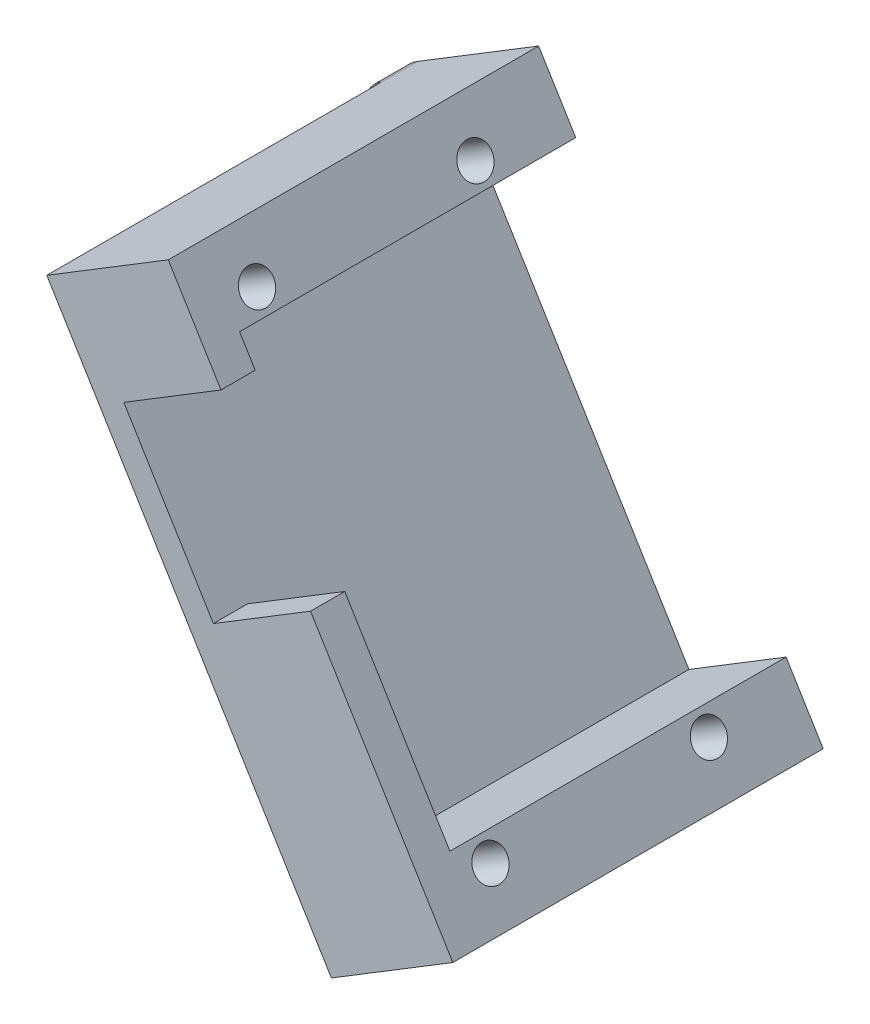
from build123d import *

# Parameters (mm, degrees)
BOSS_EXTRUDE1_DEPTH                               = 3.048
BOSS_EXTRUDE2_DEPTH                               = 29.971999999999998
BOSS_EXTRUDE3_DEPTH                               = 3.048
BOSS_EXTRUDE4_DEPTH                               = 3.048
SKETCH13_W                                        = 29.972
SKETCH13_H                                        = 48.7
BOSS_EXTRUDE5_DEPTH                               = 3.048
CSK_FOR_4_FLAT_HEAD_MACHINE_SCREW_100_D           = 2.9464
CSK_FOR_4_FLAT_HEAD_MACHINE_SCREW_100_CSINK_D     = 5.715
CSK_FOR_4_FLAT_HEAD_MACHINE_SCREW_100_CSINK_ANGLE = 100
CUT_EXTRUDE1_DEPTH                                = 1.397
CUT_EXTRUDE1_DEPTH_BACK                           = 1.397
SKETCH15_R                                        = 9.184035329670005
SKETCH15_R_2                                      = 8.124741076595411
SKETCH15_R_3                                      = 8.201451240556812
SKETCH15_R_4                                      = 5.810172256980604
BOSS_EXTRUDE6_DEPTH                               = 3.048
CSK_FOR_4_FLAT_HEAD_MACHINE_SCREW1_AT_2_COUNT     = 2
CSK_FOR_4_FLAT_HEAD_MACHINE_SCREW1_AT_2_PITCH     = 35.474094707842795
CSK_FOR_4_FLAT_HEAD_MACHINE_SCREW1_AT_3_COUNT     = 2
CSK_FOR_4_FLAT_HEAD_MACHINE_SCREW1_AT_3_PITCH     = 43.70753982500484
CSK_FOR_4_FLAT_HEAD_MACHINE_SCREW1_AT_4_COUNT     = 2
CSK_FOR_4_FLAT_HEAD_MACHINE_SCREW1_AT_4_PITCH     = 25.069264350610375
CUT_EXTRUDE2_DEPTH                                = 3.048
FILLET3_R                                         = 3.8099999999999996
FILLET4_R                                         = 1.27
SKETCH21_W                                        = 2.540000000000001
SKETCH21_H                                        = 33.02
CUT_EXTRUDE3_DEPTH                                = 77.47
FILLET5_R                                         = 0.508
FILLET6_R                                         = 0.508
SKETCH22_W                                        = 123.04970813102194
SKETCH22_H                                        = 134.7131875745612
CUT_EXTRUDE4_DEPTH                                = 61.72200000000001


with BuildPart() as part:
    # Sketch2 → Boss-Extrude1 (new body)
    with BuildSketch(Plane.XY):
        Polygon((-47.58059551455695, 48.12489153745831), (-22.21147896413696, 6.554494312375088), (5.701292889255674, 23.58878817682547), (-19.667823661164306, 65.1591854019087), align=None)
        Polygon((-38.85234269167306, 46.0124042215628), (-20.098991648241444, 15.282747135258976), (-3.0269599336282123, 25.701275492720985), (-21.78031097705982, 56.430932579024805), align=None, mode=Mode.SUBTRACT)
    extrude(amount=BOSS_EXTRUDE1_DEPTH)

    # Sketch3 → Boss-Extrude2 (add)
    with BuildSketch(Plane.XY.offset(3.048)):
        Polygon((2.4490708476218597, 21.604058524728963), (-22.920045702798127, 63.17445574981219), (-44.328373472923126, 50.10962118955482), (-18.95925692250314, 8.539223964471608), align=None)
        Polygon((-38.85234269167306, 46.0124042215628), (-20.098991648241444, 15.282747135258976), (-3.0269599336282087, 25.701275492720985), (-21.78031097705982, 56.430932579024805), align=None, mode=Mode.SUBTRACT)
    extrude(amount=BOSS_EXTRUDE2_DEPTH)

    # Sketch4 → Boss-Extrude3 (add)
    with BuildSketch(Plane.XY.offset(33.02)):
        Polygon((-38.85234269167306, 46.0124042215628), (-37.46131723814535, 43.733039051773666), (-20.389285523532113, 54.15156740923567), (-21.78031097705982, 56.430932579024805), align=None)
        Polygon((-29.47566716995725, 30.647575678410885), (-12.403635455344016, 41.0661040358729), (-3.0269599336282087, 25.701275492720985), (-20.098991648241444, 15.282747135258976), align=None)
    extrude(amount=-BOSS_EXTRUDE3_DEPTH)

    # Sketch12 → Boss-Extrude4 (add)
    with BuildSketch(Plane.XY.offset(3.048)):
        Polygon((2.4490708476218597, 21.604058524728963), (5.701292889255674, 23.58878817682547), (8.120429940678708, 25.065112049236276), (-17.248686609741274, 66.6355092743195), (-22.920045702798127, 63.17445574981219), align=None)
    extrude(amount=-BOSS_EXTRUDE4_DEPTH)

    # Sketch13 → Boss-Extrude5 (add)
    with BuildSketch(Plane(origin=(11.391019162328917, 6.95158362794815, 0), x_dir=(0, 0, -1), z_dir=(0.8536015857306615, 0.5209264178731006, 0))):
        with Locations((-18.034000000000002, 41.515472911157566)):
            Rectangle(SKETCH13_W, SKETCH13_H)
    extrude(amount=BOSS_EXTRUDE5_DEPTH)

    # CSK for #4 Flat Head Machine Screw (100)2 (through all)
    with Locations(Plane(origin=(-10.017308607796087, -6.113250932309213, 0), x_dir=(0, 0, 1), z_dir=(-0.8536015857306615, -0.5209264178731007, 0))):
        with Locations((27.397617355, 61.471448289), (7.925915452, 61.471448289), (7.925915452, 21.515515982), (27.397617355, 21.515515982)):
            CounterSinkHole(CSK_FOR_4_FLAT_HEAD_MACHINE_SCREW_100_D / 2, CSK_FOR_4_FLAT_HEAD_MACHINE_SCREW_100_CSINK_D / 2, counter_sink_angle=CSK_FOR_4_FLAT_HEAD_MACHINE_SCREW_100_CSINK_ANGLE)

    # Sketch14 → Cut-Extrude1 (cut, two sides: drawn at the far end of the back side and taken through both)
    with BuildSketch(Plane(origin=(11.607833965104508, 7.083898938087922, 0), x_dir=(0, 0, -1), z_dir=(0.8536015857306615, 0.5209264178731005, 0)).offset(-CUT_EXTRUDE1_DEPTH_BACK)):
        Polygon((-30.697174143874744, 19.61051598216394), (-30.697174143874744, 14.979833054183299), (-24.09806056703731, 14.979833054183299), (-24.09806056703731, 19.610515982163985), (-24.098060567037347, 23.42051598216399), (-27.39761735545604, 25.325515982163957), (-30.697174143874758, 23.420515982163952), align=None)
        Polygon((-27.39761735545604, 57.661448288693826), (-24.098060567037333, 59.56644828869383), (-24.098060567037336, 63.37644828869381), (-24.098060567037336, 70.99644828869384), (-30.69717414387474, 70.99644828869384), (-30.69717414387474, 63.37644828869381), (-30.69717414387474, 59.56644828869381), align=None)
        Polygon((-7.925915451689084, 57.661448288693826), (-4.626358663270381, 59.56644828869382), (-4.626358663270402, 63.37644828869381), (-4.626358663270402, 70.99644828869384), (-11.225472240107786, 70.99644828869384), (-11.225472240107786, 63.376448288693766), (-11.225472240107747, 59.566448288693785), align=None)
        Polygon((-7.925915451689081, 25.325515982163946), (-11.225472240107791, 23.42051598216395), (-11.225472240107791, 19.610515982163946), (-11.225472240107791, 14.979833054183299), (-4.626358663270366, 14.979833054183299), (-4.626358663270366, 19.610515982163953), (-4.6263586632703655, 23.420515982163952), align=None)
    extrude(amount=CUT_EXTRUDE1_DEPTH + CUT_EXTRUDE1_DEPTH_BACK, mode=Mode.SUBTRACT)

    # Sketch15 → Boss-Extrude6 (add)
    with BuildSketch(Plane(origin=(0, 0, 0), x_dir=(-1, 0, 0), z_dir=(0, 0, -1))):
        with Locations((9.758086495919196, 54.36124573948299)):
            Circle(SKETCH15_R)
        with Locations((39.927818301519274, 35.58488100974543)):
            Circle(SKETCH15_R_2)
        with Locations((25.610425726235285, 18.04643091882164)):
            Circle(SKETCH15_R_3)
        with Locations((-3.4576236647063787, 32.70568986323082)):
            Circle(SKETCH15_R_4)
    extrude(amount=-BOSS_EXTRUDE6_DEPTH)

    # Sketch19 → CSK for #4 Flat Head Machine Screw1 (revolve, cut)
    with BuildSketch(Plane(origin=(3.764373982237945, 32.86032278852424, 3.048), x_dir=(0, -1, 0), z_dir=(1, 0, 0))):
        Polygon((0, 0), (-7.5e-16, 3.0480000000000023), (1.4731999999999932, 3.0480000000000023), (1.4731999999999934, 1.59245498611605), (2.857499999999999, -1.73e-15), align=None)
    csk_for_4_flat_head_machine_screw1 = revolve(axis=Axis((3.764373982237945, 32.86032278852424, 9.39799999999999), (0, 0, -1)), mode=Mode.SUBTRACT)

    # CSK for #4 Flat Head Machine Screw1 at 2: CSK for #4 Flat Head Machine Screw1 ×2
    with Locations(*[Vector(-0.8506492202713736, -0.5257336816789507, 0) * (i * CSK_FOR_4_FLAT_HEAD_MACHINE_SCREW1_AT_2_PITCH) for i in range(1, CSK_FOR_4_FLAT_HEAD_MACHINE_SCREW1_AT_2_COUNT)]):
        add(csk_for_4_flat_head_machine_screw1, mode=Mode.SUBTRACT)

    # CSK for #4 Flat Head Machine Screw1 at 3: CSK for #4 Flat Head Machine Screw1 ×2
    with Locations(*[Vector(-0.997755305773639, 0.06696528802709796, 0) * (i * CSK_FOR_4_FLAT_HEAD_MACHINE_SCREW1_AT_3_PITCH) for i in range(1, CSK_FOR_4_FLAT_HEAD_MACHINE_SCREW1_AT_3_COUNT)]):
        add(csk_for_4_flat_head_machine_screw1, mode=Mode.SUBTRACT)

    # CSK for #4 Flat Head Machine Screw1 at 4: CSK for #4 Flat Head Machine Screw1 ×2
    with Locations(*[Vector(-0.5210117203175807, 0.8535495224600124, 0) * (i * CSK_FOR_4_FLAT_HEAD_MACHINE_SCREW1_AT_4_PITCH) for i in range(1, CSK_FOR_4_FLAT_HEAD_MACHINE_SCREW1_AT_4_COUNT)]):
        add(csk_for_4_flat_head_machine_screw1, mode=Mode.SUBTRACT)

    # Sketch20 → Cut-Extrude2 (cut)
    with BuildSketch(Plane(origin=(0, 0, 0), x_dir=(-1, 0, 0), z_dir=(0, 0, -1))):
        with BuildLine():
            Line((14.542293121824187, 62.20075286029573), (11.563953125478477, 57.32037886408755))
            ThreePointArc((11.563953125478477, 57.32037886408755), (6.044784522535942, 56.24291105550805), (7.610320649443919, 50.84186897257834))
            Line((7.610320649443919, 50.84186897257834), (-1.4954062126549716, 35.92102291440944))
            ThreePointArc((-1.4954062126549716, 35.92102291440944), (-7.016596023871767, 34.845052440620755), (-5.448804035753348, 29.442897530407524))
            Line((-5.448804035753348, 29.442897530407524), (-6.484295885760952, 27.746117611303884))
            Line((-6.484295885760952, 27.746117611303884), (-6.762670750549963, 27.28996638176623))
            Line((-6.762670750549963, 27.28996638176623), (-14.061950278269341, 31.74448896114331))
            Line((-14.061950278269341, 31.74448896114331), (8.559037851416688, 68.81174198534737))
            Line((8.559037851416688, 68.81174198534737), (14.542293121824187, 65.16034795406075))
            Line((14.542293121824187, 65.16034795406075), (14.542293121824187, 62.20075286029573))
        make_face()
        Polygon((21.78031097705982, 56.430932579024805), (38.85234269167306, 46.0124042215628), (20.098991648241444, 15.282747135258976), (3.0269599336282123, 25.701275492720985), align=None)
        with BuildLine():
            Line((22.21147896413696, 6.554494312375088), (24.781951964671258, 10.766528400207497))
            ThreePointArc((24.781951964671258, 10.766528400207497), (29.66385906245521, 12.225666721445755), (28.72915433514684, 17.23450177808784))
            Line((28.72915433514684, 17.23450177808784), (38.012718373529104, 32.44675577885475))
            ThreePointArc((38.012718373529104, 32.44675577885475), (43.097277822107074, 33.802481129765034), (41.97793801322115, 38.944252653808825))
            Line((41.97793801322115, 38.944252653808825), (47.58059551455695, 48.12489153745831))
            Line((47.58059551455695, 48.12489153745831), (51.80171473929435, 35.787210781861546))
            Line((51.80171473929435, 35.787210781861546), (47.57680035710003, 5.227667032097241))
            Line((47.57680035710003, 5.227667032097241), (22.21147896413696, 6.554494312375088))
        make_face()
    extrude(amount=-CUT_EXTRUDE2_DEPTH, mode=Mode.SUBTRACT)


with BuildPart() as body_2:
    # of the pieces the cut leaves, the one that is kept (cut_extrude2_keep)
    add(part.part.solids().sort_by_distance((-47.580595515, 48.124891537, 0))[0])

    # Fillet3
    fillet3_edges = [body_2.edges().sort_by_distance(p)[0] for p in [
        (-17.248686609741274, 66.6355092743195, 1.524),
        (-47.58059551455695, 48.12489153745831, 1.524),
        (-22.21147896413696, 6.554494312375088, 1.524),
        (8.120429940678708, 25.065112049236276, 1.524),
    ]]
    fillet(fillet3_edges, radius=FILLET3_R)

    # Fillet4
    fillet4_edges = [body_2.edges().sort_by_distance(p)[0] for p in [
        (-24.781951964671258, 10.766528400207495, 1.524),
        (-28.72915433514684, 17.23450177808784, 1.524),
        (-38.0127183735291, 32.44675577885475, 1.524),
        (-41.97793801322115, 38.94425265380882, 1.524),
        (-11.563953125478475, 57.320378864087544, 1.524),
        (-7.610320649443917, 50.84186897257834, 1.524),
        (1.4954062126549714, 35.92102291440944, 1.524),
    ]]
    fillet(fillet4_edges, radius=FILLET4_R)

    # Sketch21 → Cut-Extrude3 (cut)
    with BuildSketch(Plane(origin=(-8.941948314707059, 14.652474896780824, 0), x_dir=(0.8536015857306616, 0.5209264178731006, 0), z_dir=(0.5209264178731005, -0.8536015857306615, 0))):
        with Locations((2.2216732427396275, 16.51)):
            Rectangle(SKETCH21_W, SKETCH21_H)
    extrude(amount=-CUT_EXTRUDE3_DEPTH, mode=Mode.SUBTRACT)


with BuildPart() as cut_extrude3_piece_1:
    # of the separate pieces the step leaves, piece 1, a body of its own (cut_extrude3_pieces)
    add(body_2.part.solids().sort_by_distance((-12.188709065, 58.344117807, 0))[0])

    # Fillet6
    fillet6_edges = [cut_extrude3_piece_1.edges().sort_by_distance(p)[0] for p in [
        (-7.633709794281099, 43.97704085894782, 3.048),
    ]]
    fillet(fillet6_edges, radius=FILLET6_R)

    # Sketch22 → Cut-Extrude4 (cut)
    with BuildSketch(Plane(origin=(2.067982642978631, 1.2620252919381492, 0), x_dir=(0, 0, -1), z_dir=(0.8536015857306616, 0.5209264178731006, 0))):
        with Locations((-42.687564536567926, 74.45417523171726)):
            Rectangle(SKETCH22_W, SKETCH22_H)
    extrude(amount=CUT_EXTRUDE4_DEPTH, mode=Mode.SUBTRACT)


with BuildPart() as cut_extrude3_piece_2:
    # of the separate pieces the step leaves, piece 2, a body of its own (cut_extrude3_pieces)
    add(body_2.part.solids().sort_by_distance((-42.532157132, 39.852408399, 0))[0])

    # Fillet5
    fillet5_edges = [cut_extrude3_piece_2.edges().sort_by_distance(p)[0] for p in [
        (-31.64381519771313, 29.324422577013216, 3.048),
    ]]
    fillet(fillet5_edges, radius=FILLET5_R)


solid = cut_extrude3_piece_2.part
